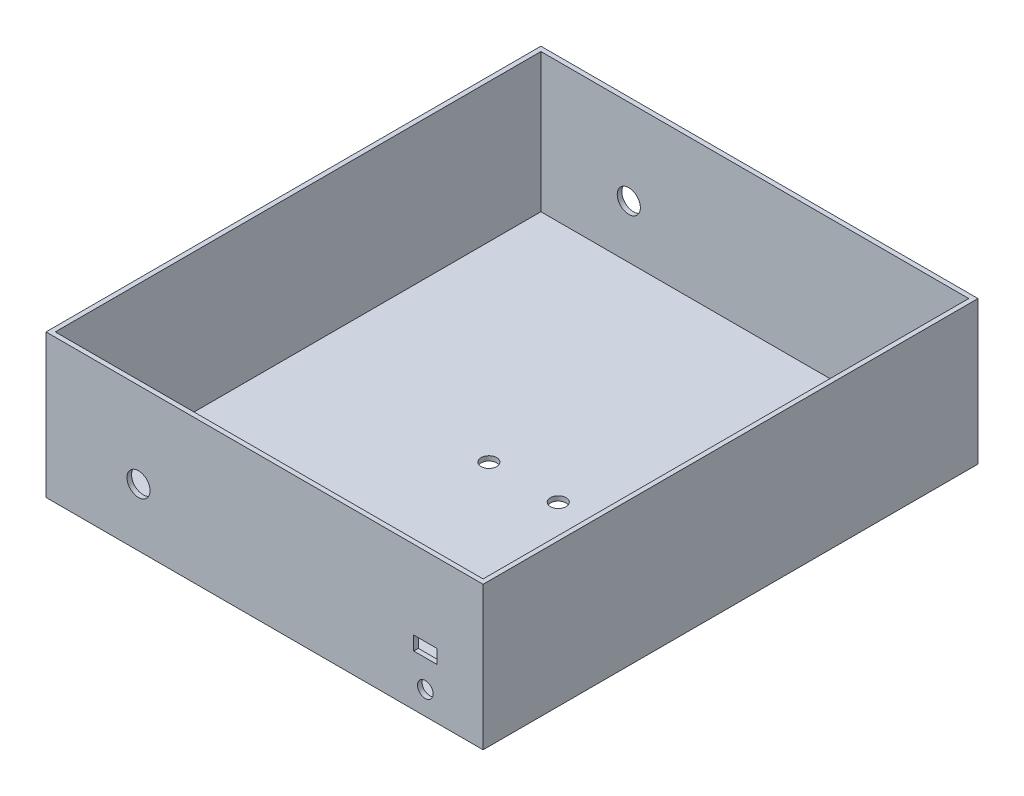
from build123d import *

# Parameters (mm, degrees)
SKETCH2_W               = 189
SKETCH2_H               = 214
SKETCH2_W_2             = 185
SKETCH2_H_2             = 210
WALLS_DEPTH             = 60
SKETCH3_W               = 189
SKETCH3_H               = 214
BASE_DEPTH              = 2
SKETCH4_R               = 5
SKETCH4_W               = 10
SKETCH4_H               = 6
CUT_EXTRUDE1_DEPTH      = 242.508281432
SKETCH5_R               = 3.3782
CUT_EXTRUDE2_DEPTH      = 242.508281432
F_1_4_CLEARANCE_HOLE1_D = 6.7564


with BuildPart() as part:
    # Sketch2 → Walls (new body)
    with BuildSketch(Plane(origin=(0, 0, 0), x_dir=(1, 0, 0), z_dir=(0, 1, 0))):
        Rectangle(SKETCH2_W, SKETCH2_H)
        Rectangle(SKETCH2_W_2, SKETCH2_H_2, mode=Mode.SUBTRACT)
    extrude(amount=WALLS_DEPTH)

    # Sketch3 → Base (add)
    with BuildSketch(Plane.XZ):
        Rectangle(SKETCH3_W, SKETCH3_H)
    extrude(amount=BASE_DEPTH)

    # Sketch4 → Cut-Extrude1 (cut, through all)
    with BuildSketch(Plane(origin=(0, 0, -107), x_dir=(-1, 0, 0), z_dir=(0, 0, -1))):
        with Locations((54.5, 23)):
            Circle(SKETCH4_R)
        with Locations((-69.5, 23)):
            Rectangle(SKETCH4_W, SKETCH4_H)
    extrude(amount=-CUT_EXTRUDE1_DEPTH, mode=Mode.SUBTRACT)

    # Sketch5 → Cut-Extrude2 (cut, through all)
    with BuildSketch(Plane(origin=(0, 0, -107), x_dir=(-1, 0, 0), z_dir=(0, 0, -1))):
        with Locations((-69.5, 8.09625)):
            Circle(SKETCH5_R)
    extrude(amount=-CUT_EXTRUDE2_DEPTH, mode=Mode.SUBTRACT)

    # 1/4 Clearance Hole1 (through all)
    with Locations(Plane(origin=(0, -2, 0), x_dir=(-1, 0, 0), z_dir=(0, -1, 0))):
        with Locations((-20, 0), (10, 0)):
            Hole(F_1_4_CLEARANCE_HOLE1_D / 2)


solid = part.part
